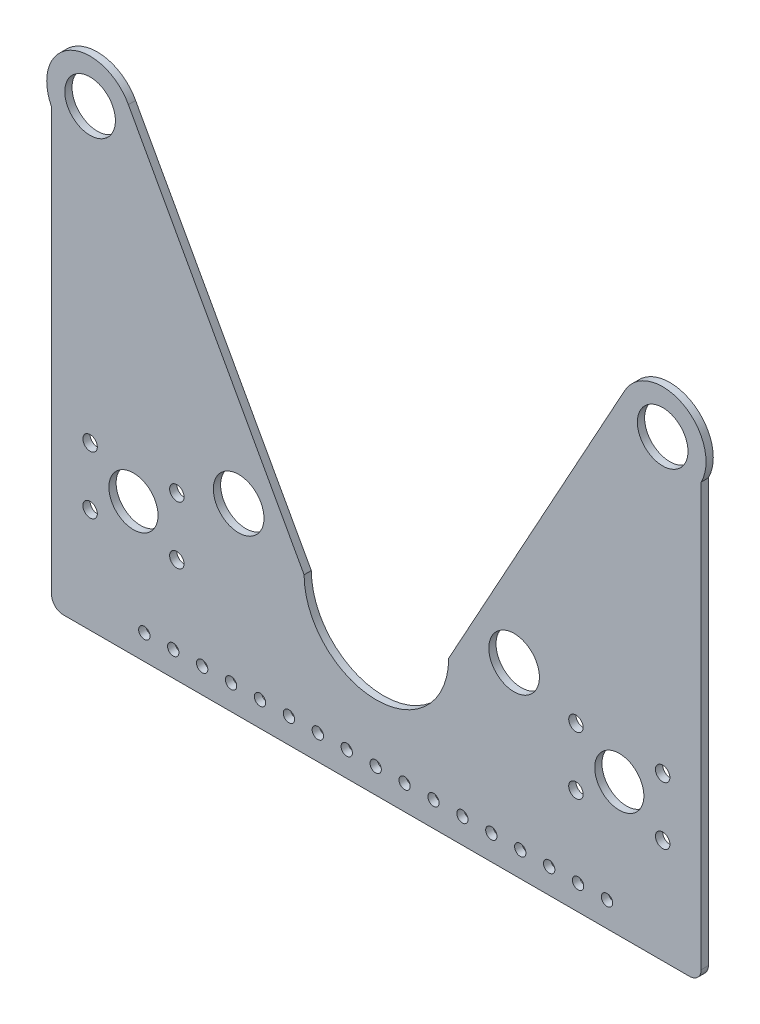
from build123d import *

# Parameters (mm, degrees)
SKETCH2_R           = 2.4892
SKETCH2_R_2         = 3.175
SKETCH2_R_3         = 10.795
SKETCH2_R_4         = 11.1125
BOSS_EXTRUDE1_DEPTH = 3.175


with BuildPart() as part:
    # Sketch2 → Boss-Extrude1 (new body)
    with BuildSketch(Plane.XY):
        with BuildLine():
            Line((142.632381685, -29.937060043), (142.632381685, 122.462939957))
            ThreePointArc((142.632381685, 122.462939957), (134.600001748, 148.101160684), (108.918256202, 140.209048468))
            Line((108.918256202, 140.209048468), (31.75, 0))
            ThreePointArc((31.75, 0), (0, -31.75), (-31.75, 0))
            Line((-31.75, 0), (-108.918256202, 140.209048469))
            ThreePointArc((-108.918256202, 140.209048469), (-134.600001748, 148.101160684), (-142.632381685, 122.462939957))
            Line((-142.632381685, 122.462939957), (-142.632381685, -29.937060043))
            Line((-142.632381685, -29.937060043), (-142.632381685, -57.15))
            Line((-142.632381685, -57.15), (-142.632381685, -63.028571866))
            ThreePointArc((-142.632381685, -63.028571866), (-141.144484133, -66.620674314), (-137.552381685, -68.108571866))
            Line((-137.552381685, -68.108571866), (137.552381685, -68.108571866))
            ThreePointArc((137.552381685, -68.108571866), (141.144484133, -66.620674314), (142.632381685, -63.028571866))
            Line((142.632381685, -63.028571866), (142.632381685, -57.15))
            Line((142.632381685, -57.15), (142.632381685, -29.937060043))
        make_face()
        with Locations((-101.9175, -57.15)):
            Circle(SKETCH2_R, mode=Mode.SUBTRACT)
        with Locations((-89.2175, -57.15)):
            Circle(SKETCH2_R, mode=Mode.SUBTRACT)
        with Locations((-76.5175, -57.15)):
            Circle(SKETCH2_R, mode=Mode.SUBTRACT)
        with Locations((-125.73, -22.225)):
            Circle(SKETCH2_R_2, mode=Mode.SUBTRACT)
        with Locations((-87.63, -22.225)):
            Circle(SKETCH2_R_2, mode=Mode.SUBTRACT)
        with Locations((-63.8175, -57.15)):
            Circle(SKETCH2_R, mode=Mode.SUBTRACT)
        with Locations((-51.1175, -57.15)):
            Circle(SKETCH2_R, mode=Mode.SUBTRACT)
        with Locations((-38.4175, -57.15)):
            Circle(SKETCH2_R, mode=Mode.SUBTRACT)
        with Locations((-25.7175, -57.15)):
            Circle(SKETCH2_R, mode=Mode.SUBTRACT)
        with Locations((-13.0175, -57.15)):
            Circle(SKETCH2_R, mode=Mode.SUBTRACT)
        with Locations((-0.3175, -57.15)):
            Circle(SKETCH2_R, mode=Mode.SUBTRACT)
        with Locations((-125.73, 3.175)):
            Circle(SKETCH2_R_2, mode=Mode.SUBTRACT)
        with Locations((-106.68, -9.525)):
            Circle(SKETCH2_R_3, mode=Mode.SUBTRACT)
        with Locations((-87.63, 3.175)):
            Circle(SKETCH2_R_2, mode=Mode.SUBTRACT)
        with Locations((-60.484532313, 12.7)):
            Circle(SKETCH2_R_4, mode=Mode.SUBTRACT)
        with Locations((12.3825, -57.15)):
            Circle(SKETCH2_R, mode=Mode.SUBTRACT)
        with Locations((25.0825, -57.15)):
            Circle(SKETCH2_R, mode=Mode.SUBTRACT)
        with Locations((37.7825, -57.15)):
            Circle(SKETCH2_R, mode=Mode.SUBTRACT)
        with Locations((50.4825, -57.15)):
            Circle(SKETCH2_R, mode=Mode.SUBTRACT)
        with Locations((63.1825, -57.15)):
            Circle(SKETCH2_R, mode=Mode.SUBTRACT)
        with Locations((75.8825, -57.15)):
            Circle(SKETCH2_R, mode=Mode.SUBTRACT)
        with Locations((88.5825, -57.15)):
            Circle(SKETCH2_R, mode=Mode.SUBTRACT)
        with Locations((101.2825, -57.15)):
            Circle(SKETCH2_R, mode=Mode.SUBTRACT)
        with Locations((87.63, -22.225)):
            Circle(SKETCH2_R_2, mode=Mode.SUBTRACT)
        with Locations((125.73, -22.225)):
            Circle(SKETCH2_R_2, mode=Mode.SUBTRACT)
        with Locations((60.484532313, 12.7)):
            Circle(SKETCH2_R_4, mode=Mode.SUBTRACT)
        with Locations((106.68, -9.525)):
            Circle(SKETCH2_R_3, mode=Mode.SUBTRACT)
        with Locations((87.63, 3.175)):
            Circle(SKETCH2_R_2, mode=Mode.SUBTRACT)
        with Locations((125.73, 3.175)):
            Circle(SKETCH2_R_2, mode=Mode.SUBTRACT)
        with Locations((-125.726814921, 131.243846084)):
            Circle(SKETCH2_R_4, mode=Mode.SUBTRACT)
        with Locations((125.726814921, 131.243846084)):
            Circle(SKETCH2_R_4, mode=Mode.SUBTRACT)
    extrude(amount=BOSS_EXTRUDE1_DEPTH)


solid = part.part
